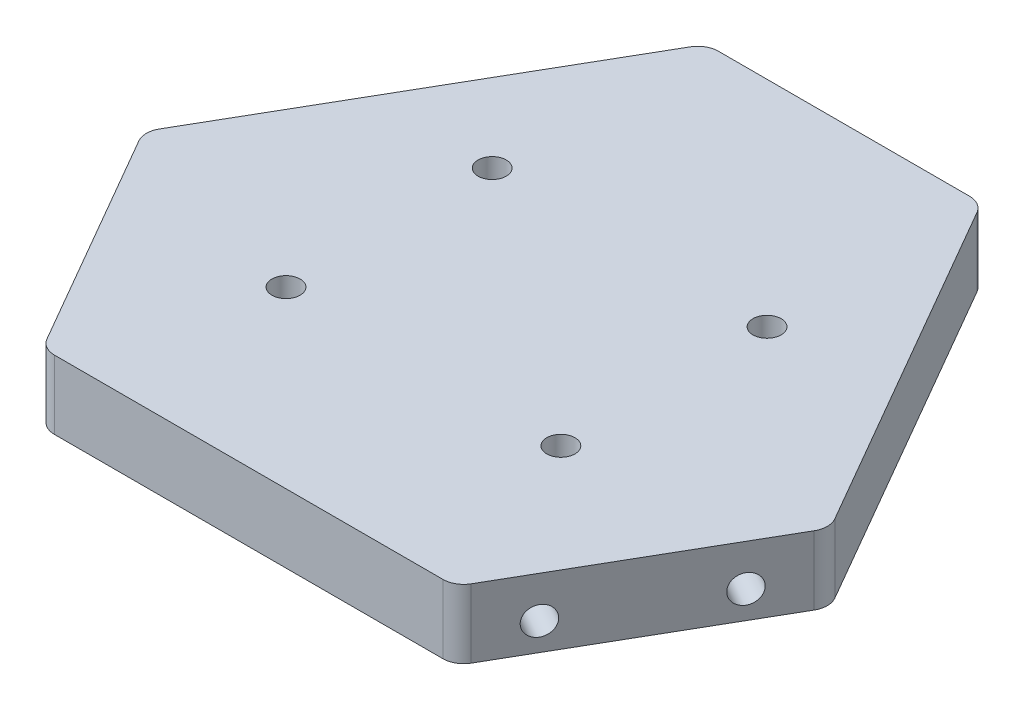
from build123d import *

# Parameters (mm, degrees)
BOSS_EXTRUDE1_DEPTH     = 5
CHAMFER1_SIZE           = 40
SKETCH4_R               = 1.5
CUT_EXTRUDE1_DEPTH      = 10
SKETCH10_R              = 2.05
CUT_EXTRUDE3_DEPTH      = 6
CRVPATTERN1_START       = -46.188021535
CRVPATTERN1_OUTLINE_R   = 2.05
CRVPATTERN1_DEPTH       = 6
CRVPATTERN1_START_2     = -40.188021535
CRVPATTERN1_2_OUTLINE_R = 1.5
CRVPATTERN1_2_DEPTH     = 4
CRVPATTERN1_3_OUTLINE_R = 2.05
CRVPATTERN1_3_DEPTH     = 6
CRVPATTERN1_4_OUTLINE_R = 1.5
CRVPATTERN1_4_DEPTH     = 4
F_3_0MM_DOWEL_HOLE1_D   = 3
FILLET1_R               = 3
SKETCH9_R               = 2.05
CUT_EXTRUDE2_DEPTH      = 6


# Read off the part's stored shape, not the designer's step: CrvPattern1
with BuildPart() as part:
    # Sketch2 → Boss-Extrude1 (new, symmetric)
    with BuildSketch(Plane(origin=(0, 0, 0), x_dir=(1, 0, 0), z_dir=(0, 1, 0))):
        Polygon((70, -40.414518843), (0, 80.829037687), (-70, -40.414518843), align=None)
    extrude(amount=BOSS_EXTRUDE1_DEPTH, both=True)

    # Chamfer1
    chamfer1_edges = [part.edges().sort_by_distance(p)[0] for p in [
        (-70, 0, 40.414518843),
        (0, 0, -80.829037687),
        (70, 0, 40.414518843),
    ]]
    chamfer(chamfer1_edges, length=CHAMFER1_SIZE)

    # Sketch4 → Cut-Extrude1 (cut)
    with BuildSketch(Plane(origin=(40, 0, 23.094010768), x_dir=(0.5000000000000004, 0, -0.8660254037844384), z_dir=(0.8660254037844384, 0, 0.5000000000000004))):
        with Locations((-11, -1)):
            Circle(SKETCH4_R)
        with Locations((11, -1)):
            Circle(SKETCH4_R)
    extrude(amount=-CUT_EXTRUDE1_DEPTH, mode=Mode.SUBTRACT)

    # Sketch10 → Cut-Extrude3 (cut)
    with BuildSketch(Plane(origin=(40, 0, 23.094010768), x_dir=(0.4999999999999997, 0, -0.8660254037844388), z_dir=(0.8660254037844389, 0, 0.49999999999999983))):
        with Locations((-11, -1)):
            Circle(SKETCH10_R)
        with Locations((11, -1)):
            Circle(SKETCH10_R)
    extrude(amount=-CUT_EXTRUDE3_DEPTH, mode=Mode.SUBTRACT)

    # CrvPattern1 outline → CrvPattern1 (cut)
    with BuildSketch(Plane.XY.offset(CRVPATTERN1_START)):
        with Locations((11, -1)):
            Circle(CRVPATTERN1_OUTLINE_R)
        with Locations((-11, -1)):
            Circle(CRVPATTERN1_OUTLINE_R)
    extrude(amount=CRVPATTERN1_DEPTH, mode=Mode.SUBTRACT)

    # CrvPattern1 2 outline → CrvPattern1 2 (cut)
    with BuildSketch(Plane.XY.offset(CRVPATTERN1_START_2)):
        with Locations((11, -1)):
            Circle(CRVPATTERN1_2_OUTLINE_R)
        with Locations((-11, -1)):
            Circle(CRVPATTERN1_2_OUTLINE_R)
    extrude(amount=CRVPATTERN1_2_DEPTH, mode=Mode.SUBTRACT)

    # CrvPattern1 3 outline → CrvPattern1 3 (cut)
    with BuildSketch(Plane(origin=(0, 0, 0), x_dir=(0.500000000000013, 0, 0.8660254037844313), z_dir=(0.8660254037844312, 0, -0.5000000000000131)).offset(CRVPATTERN1_START)):
        with Locations((-11, 1)):
            Circle(CRVPATTERN1_3_OUTLINE_R)
        with Locations((11, 1)):
            Circle(CRVPATTERN1_3_OUTLINE_R)
    extrude(amount=CRVPATTERN1_3_DEPTH, mode=Mode.SUBTRACT)

    # CrvPattern1 4 outline → CrvPattern1 4 (cut)
    with BuildSketch(Plane(origin=(0, 0, 0), x_dir=(0.500000000000013, 0, 0.8660254037844313), z_dir=(0.8660254037844312, 0, -0.5000000000000131)).offset(CRVPATTERN1_START_2)):
        with Locations((-11, 1)):
            Circle(CRVPATTERN1_4_OUTLINE_R)
        with Locations((11, 1)):
            Circle(CRVPATTERN1_4_OUTLINE_R)
    extrude(amount=CRVPATTERN1_4_DEPTH, mode=Mode.SUBTRACT)

    # Ø3.0mm Dowel Hole1 (through all)
    with Locations(Plane(origin=(0, 5, 0), x_dir=(1, 0, 0), z_dir=(0, 1, 0))):
        with Locations((-20, 15), (20, 15), (20, -15), (-20, -15)):
            Hole(F_3_0MM_DOWEL_HOLE1_D / 2)

    # Fillet1
    fillet1_edges = [part.edges().sort_by_distance(p)[0] for p in [
        (20, 0, -46.188021535),
        (50, 0, 5.773502692),
        (-30, 0, 40.414518843),
        (30, 0, 40.414518843),
        (-50, 0, 5.773502692),
        (-20, 0, -46.188021535),
    ]]
    fillet(fillet1_edges, radius=FILLET1_R)

    # Sketch9 → Cut-Extrude2 (cut)
    with BuildSketch(Plane(origin=(0, 5, 0), x_dir=(1, 0, 0), z_dir=(0, 1, 0))):
        with Locations(Location((-20, 15, 0), (0, 0, 270))):
            Circle(SKETCH9_R)
        with Locations(Location((20, 15, 0), (0, 0, 270))):
            Circle(SKETCH9_R)
        with Locations(Location((20, -15, 0), (0, 0, 270))):
            Circle(SKETCH9_R)
        with Locations(Location((-20, -15, 0), (0, 0, 270))):
            Circle(SKETCH9_R)
    extrude(amount=-CUT_EXTRUDE2_DEPTH, mode=Mode.SUBTRACT)


solid = part.part
